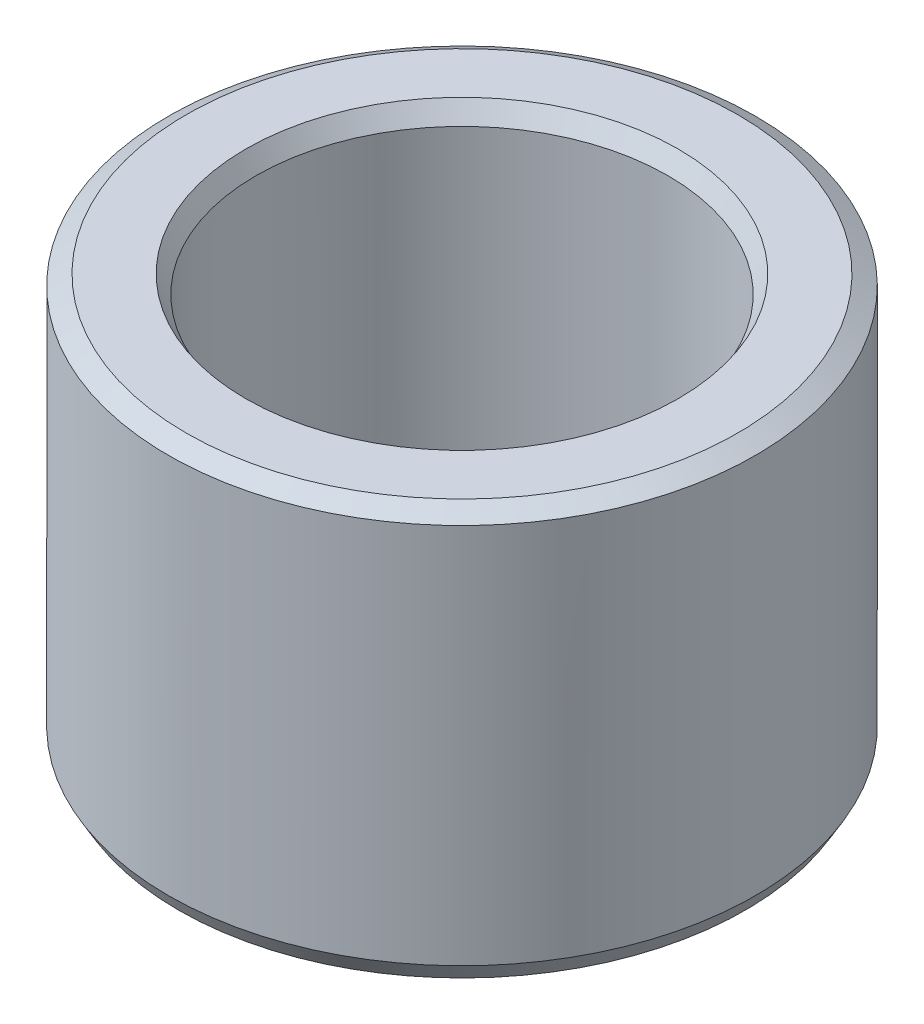
from build123d import *
from OCP.BRepFilletAPI import BRepFilletAPI_MakeChamfer

# Parameters (mm, degrees)
SKETCH1_R           = 55
BOSS_EXTRUDE1_DEPTH = 76.683817956
SKETCH2_R           = 38.566299641
CUT_EXTRUDE1_DEPTH  = 110.226406772
CHAMFER1_SIZE       = 1.934674636
CHAMFER1_SIZE2      = 3.350954765


with BuildPart() as part:
    # Sketch1 → Boss-Extrude1 (new body)
    with BuildSketch(Plane(origin=(0, 0, 0), x_dir=(1, 0, 0), z_dir=(0, 1, 0))):
        Circle(SKETCH1_R)
    extrude(amount=BOSS_EXTRUDE1_DEPTH)

    # Sketch2 → Cut-Extrude1 (cut, through all)
    with BuildSketch(Plane(origin=(0, 0, 0), x_dir=(1, 0, 0), z_dir=(0, 1, 0))):
        Circle(SKETCH2_R)
    extrude(amount=CUT_EXTRUDE1_DEPTH, mode=Mode.SUBTRACT)

    # Chamfer1: one chamfer whose edges measure the first distance from different faces: ONE call of the kernel's chamfer builder (chamfer() names one face for all edges)
    chamfer1_edges_1 = [part.edges().sort_by_distance(p)[0] for p in [
        (-38.566299641, 76.683817956, 0),
    ]]
    chamfer1_side_1 = [part.faces().sort_by_distance(p)[0] for p in [
        (-53.444365081, 76.683817956, 0),
    ]]
    chamfer1_edges_2 = [part.edges().sort_by_distance(p)[0] for p in [
        (-38.566299641, 0, 0),
    ]]
    chamfer1_side_2 = [part.faces().sort_by_distance(p)[0] for p in [
        (-38.566299641, 38.341908978, 0),
    ]]
    chamfer1_edges_3 = [part.edges().sort_by_distance(p)[0] for p in [
        (-55, 0, 0),
    ]]
    chamfer1_side_3 = [part.faces().sort_by_distance(p)[0] for p in [
        (-53.444365081, 0, 0),
    ]]
    chamfer1_edges_4 = [part.edges().sort_by_distance(p)[0] for p in [
        (-55, 76.683817956, 0),
    ]]
    chamfer1_side_4 = [part.faces().sort_by_distance(p)[0] for p in [
        (-55, 38.341908978, 0),
    ]]
    chamfer1 = BRepFilletAPI_MakeChamfer(part.part.solid().wrapped)
    for e in chamfer1_edges_1:
        chamfer1.Add(CHAMFER1_SIZE, CHAMFER1_SIZE2, e.wrapped, chamfer1_side_1[0].wrapped)  # the first distance lies on this face
    for e in chamfer1_edges_2:
        chamfer1.Add(CHAMFER1_SIZE, CHAMFER1_SIZE2, e.wrapped, chamfer1_side_2[0].wrapped)  # the first distance lies on this face
    for e in chamfer1_edges_3:
        chamfer1.Add(CHAMFER1_SIZE, CHAMFER1_SIZE2, e.wrapped, chamfer1_side_3[0].wrapped)  # the first distance lies on this face
    for e in chamfer1_edges_4:
        chamfer1.Add(CHAMFER1_SIZE, CHAMFER1_SIZE2, e.wrapped, chamfer1_side_4[0].wrapped)  # the first distance lies on this face
    add(Compound.cast(chamfer1.Shape()), mode=Mode.REPLACE)


solid = part.part
